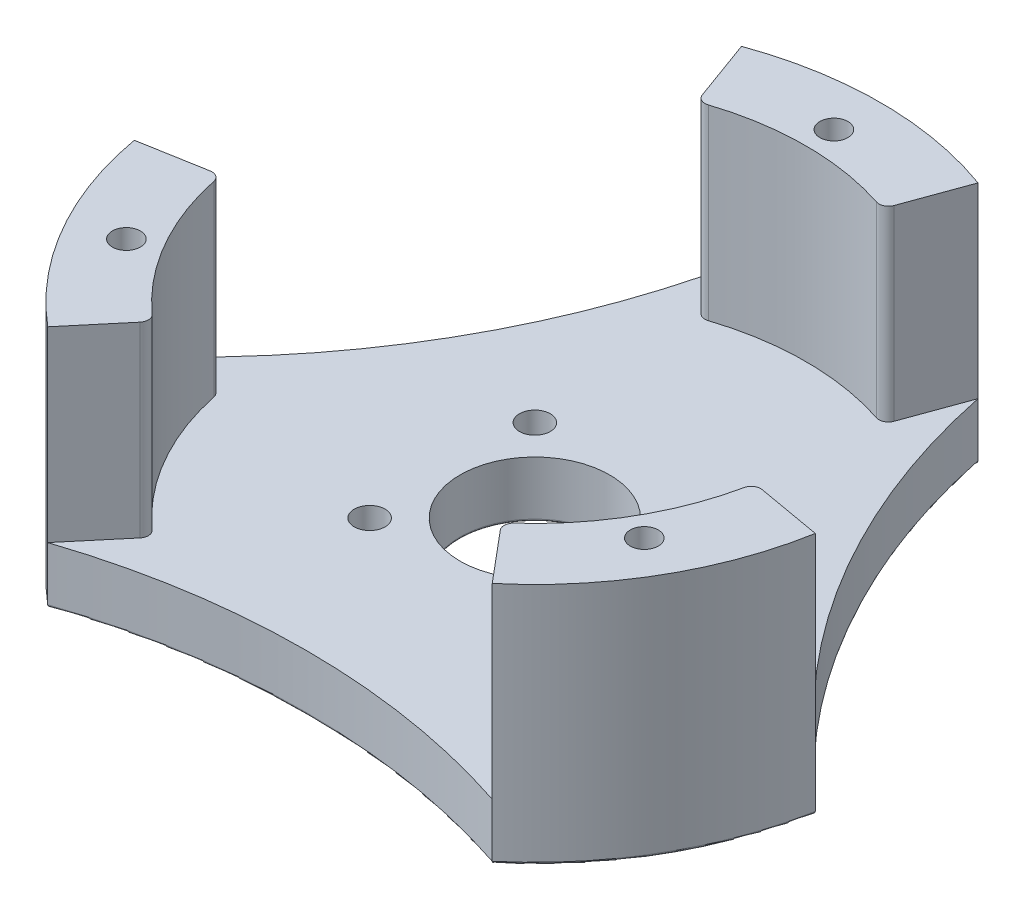
from build123d import *

# Parameters (mm, degrees)
SKETCH1_R           = 37
SKETCH1_R_2         = 1.65
BOSS_EXTRUDE1_DEPTH = 6
SKETCH2_R           = 1.5
BOSS_EXTRUDE2_DEPTH = 20
SKETCH16_R          = 1.5
CUT_EXTRUDE9_DEPTH  = 59.429444632
CIRPATTERN1_COUNT   = 3
SKETCH3_R           = 8
CUT_EXTRUDE1_DEPTH  = 10
SKETCH4_R           = 3.5
CUT_EXTRUDE2_DEPTH  = 3
SKETCH5_R           = 75.500139874
CUT_EXTRUDE3_DEPTH  = 57.017854297
CIRPATTERN2_COUNT   = 3
FILLET1_R           = 0.25
FILLET2_R           = 1


with BuildPart() as part:
    # Sketch1 → Boss-Extrude1 (new body)
    with BuildSketch(Plane(origin=(0, 0, 0), x_dir=(1, 0, 0), z_dir=(0, 1, 0))):
        Circle(SKETCH1_R)
        with Locations((-8.838834765, 8.838834765)):
            Circle(SKETCH1_R_2, mode=Mode.SUBTRACT)
        with Locations((8.838834765, 8.838834765)):
            Circle(SKETCH1_R_2, mode=Mode.SUBTRACT)
        with Locations((8.838834765, -8.838834765)):
            Circle(SKETCH1_R_2, mode=Mode.SUBTRACT)
        with Locations((-8.838834765, -8.838834765)):
            Circle(SKETCH1_R_2, mode=Mode.SUBTRACT)
    extrude(amount=BOSS_EXTRUDE1_DEPTH)

    # Sketch2 → Boss-Extrude2 (add)
    with BuildSketch(Plane(origin=(0, 6, 0), x_dir=(1, 0, 0), z_dir=(0, 1, 0))):
        with BuildLine():
            Line((-12.654745303, 34.768626969), (-9.918584156, 27.251086003))
            ThreePointArc((-9.918584156, 27.251086003), (0, 29), (9.918584156, 27.251086003))
            Line((9.918584156, 27.251086003), (12.654745303, 34.768626969))
            ThreePointArc((12.654745303, 34.768626969), (0, 37), (-12.654745303, 34.768626969))
        make_face()
        with Locations((0, 32)):
            Circle(SKETCH2_R, mode=Mode.SUBTRACT)
    boss_extrude2 = extrude(amount=BOSS_EXTRUDE2_DEPTH)

    # Sketch16 → Cut-Extrude9 (cut, through all)
    with BuildSketch(Plane(origin=(0, 26, 0), x_dir=(1, 0, 0), z_dir=(0, 1, 0))):
        with Locations((0, 32)):
            Circle(SKETCH16_R)
    cut_extrude9 = extrude(amount=-CUT_EXTRUDE9_DEPTH, mode=Mode.SUBTRACT)

    # CirPattern1: Boss-Extrude2, Cut-Extrude9 ×3 about axis
    cirpattern1_axis = Axis((0, 6, 0), (0, -1, 0))
    add([boss_extrude2.rotate(cirpattern1_axis, i * 360 / CIRPATTERN1_COUNT) for i in range(1, CIRPATTERN1_COUNT)])
    add([cut_extrude9.rotate(cirpattern1_axis, i * 360 / CIRPATTERN1_COUNT) for i in range(1, CIRPATTERN1_COUNT)], mode=Mode.SUBTRACT)

    # Sketch3 → Cut-Extrude1 (cut)
    with BuildSketch(Plane(origin=(0, 6, 0), x_dir=(1, 0, 0), z_dir=(0, 1, 0))):
        Circle(SKETCH3_R)
    extrude(amount=-CUT_EXTRUDE1_DEPTH, mode=Mode.SUBTRACT)

    # Sketch4 → Cut-Extrude2 (cut)
    with BuildSketch(Plane.XZ):
        with Locations((8.838834765, 8.838834765)):
            Circle(SKETCH4_R)
        with Locations((8.838834765, -8.838834765)):
            Circle(SKETCH4_R)
        with Locations((-8.838834765, -8.838834765)):
            Circle(SKETCH4_R)
        with Locations((-8.838834765, 8.838834765)):
            Circle(SKETCH4_R)
    extrude(amount=-CUT_EXTRUDE2_DEPTH, mode=Mode.SUBTRACT)

    # Sketch5 → Cut-Extrude3 (cut, through all)
    with BuildSketch(Plane(origin=(0, 6, 0), x_dir=(1, 0, 0), z_dir=(0, 1, 0))):
        with Locations((86.602540378, 50)):
            Circle(SKETCH5_R)
    cut_extrude3 = extrude(amount=-CUT_EXTRUDE3_DEPTH, mode=Mode.SUBTRACT)

    # CirPattern2: Cut-Extrude3 ×3 about axis
    cirpattern2_axis = Axis((0, 6, 0), (0, -1, 0))
    for i in range(1, CIRPATTERN2_COUNT):
        add(cut_extrude3.rotate(cirpattern2_axis, i * 360 / CIRPATTERN2_COUNT), mode=Mode.SUBTRACT)

    # Fillet1
    fillet1_edges = [part.edges().sort_by_distance(p)[0] for p in [
        (0, 0, 24.499860126),
        (32.04293994, 0, 18.5),
        (-32.04293994, 0, 18.5),
        (-8, 0, 0),
        (5.338834765, 0, 8.838834765),
        (5.338834765, 0, -8.838834765),
        (-12.338834765, 0, -8.838834765),
        (-12.338834765, 0, 8.838834765),
        (0, 0, -37),
        (21.217501259, 0, -12.249930063),
        (-21.217501259, 0, -12.249930063),
        (-1.5, 0, -32),
        (28.462812921, 0, 14.700961894),
        (-26.962812921, 0, 17.299038106),
    ]]
    fillet(fillet1_edges, radius=FILLET1_R)

    # Fillet2
    fillet2_edges = [part.edges().sort_by_distance(p)[0] for p in [
        (28.559424837, 16, 5.035797152),
        (9.918584156, 16, -27.251086003),
        (-9.918584156, 16, -27.251086003),
        (18.640840681, 16, 22.21528885),
        (-28.559424837, 16, 5.035797152),
        (-18.640840681, 16, 22.21528885),
    ]]
    fillet(fillet2_edges, radius=FILLET2_R)


solid = part.part
